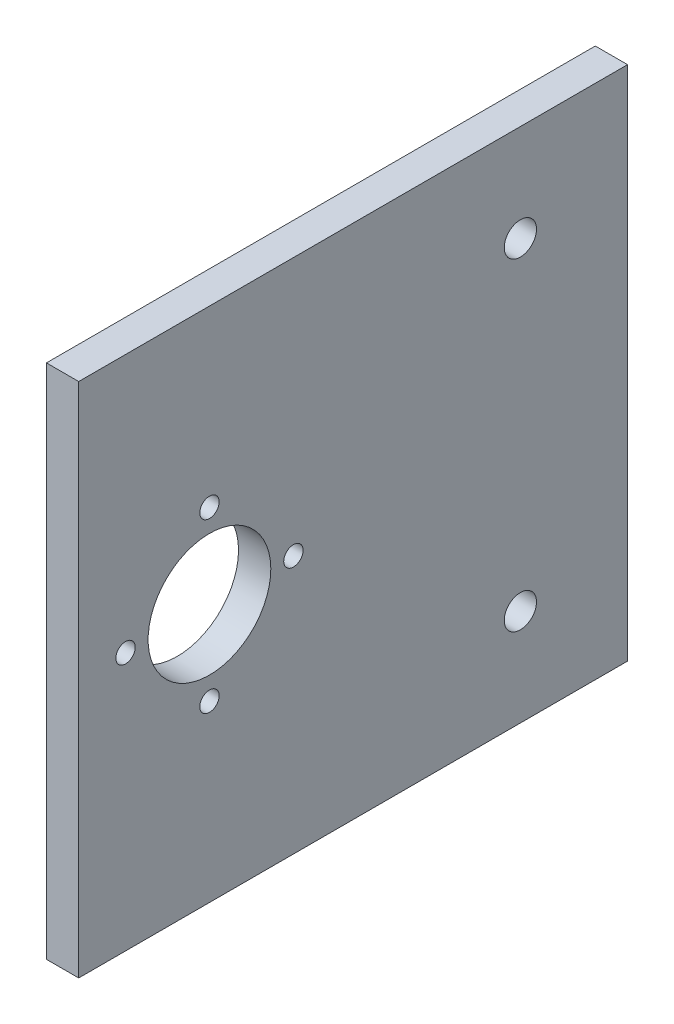
from build123d import *

# Parameters (mm, degrees)
SKETCH1_W           = 80
SKETCH1_H           = 85
SKETCH1_R           = 1.5
SKETCH1_R_2         = 9.5
SKETCH1_R_3         = 2.5
BOSS_EXTRUDE1_DEPTH = 5


with BuildPart() as part:
    # Sketch1 → Boss-Extrude1 (new body)
    with BuildSketch(Plane.YZ):
        Rectangle(SKETCH1_W, SKETCH1_H)
        with Locations((0, 35.25)):
            Circle(SKETCH1_R, mode=Mode.SUBTRACT)
        with Locations((0, 9.25)):
            Circle(SKETCH1_R, mode=Mode.SUBTRACT)
        with Locations((-13, 22.25)):
            Circle(SKETCH1_R, mode=Mode.SUBTRACT)
        with Locations((13, 22.25)):
            Circle(SKETCH1_R, mode=Mode.SUBTRACT)
        with Locations((0, 22.25)):
            Circle(SKETCH1_R_2, mode=Mode.SUBTRACT)
        with Locations((-25, -25.9)):
            Circle(SKETCH1_R_3, mode=Mode.SUBTRACT)
        with Locations((25, -25.9)):
            Circle(SKETCH1_R_3, mode=Mode.SUBTRACT)
    extrude(amount=BOSS_EXTRUDE1_DEPTH)


solid = part.part
